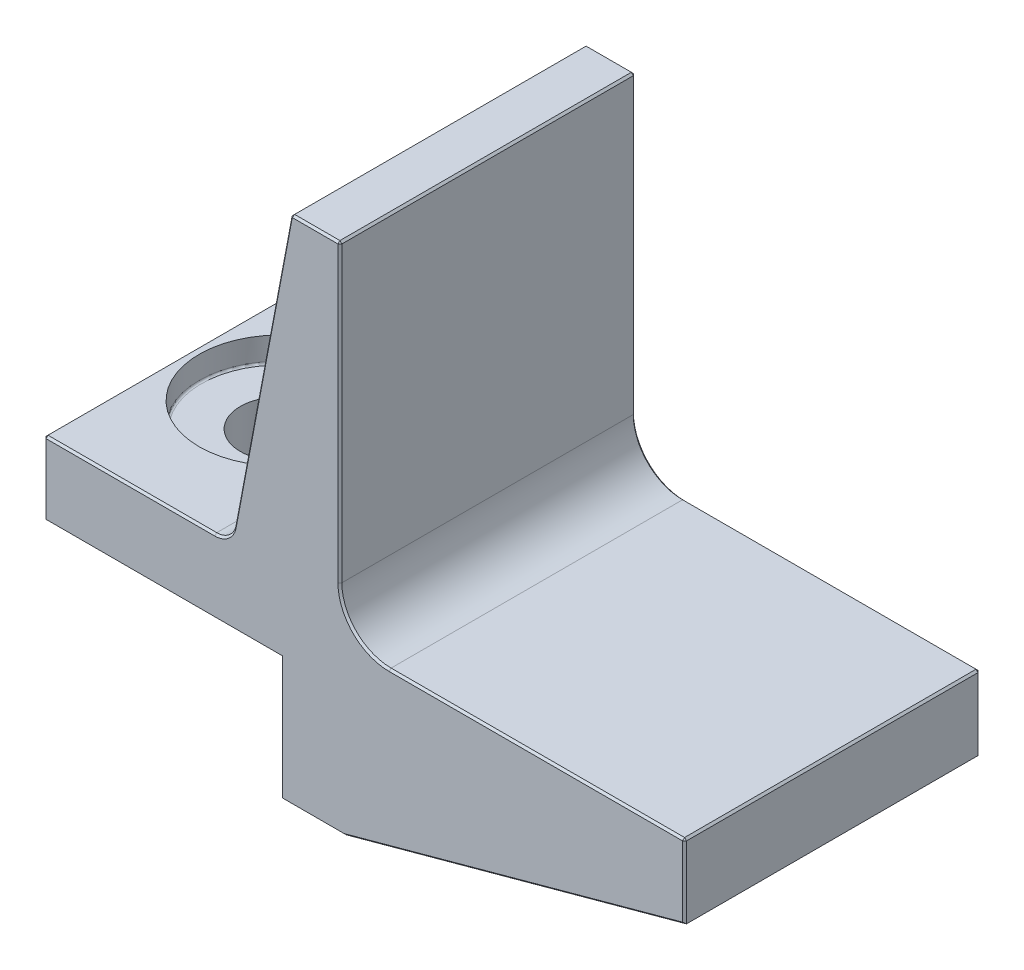
from build123d import *
from OCP.BRepFilletAPI import BRepFilletAPI_MakeChamfer

# Parameters (mm, degrees)
BOSS_EXTRUDE1_DEPTH                                  = 38.1
CBORE_FOR_3_8_BINDING_HEAD_MACHINE_SCREW_D           = 10.0838
CBORE_FOR_3_8_BINDING_HEAD_MACHINE_SCREW_CBORE_D     = 20.6756
CBORE_FOR_3_8_BINDING_HEAD_MACHINE_SCREW_CBORE_DEPTH = 3.175
FILLET1_R                                            = 2.54
FILLET2_R                                            = 6.35
CHAMFER1_SIZE                                        = 0.254
CHAMFER1_SIZE2                                       = 0.31888992
FILLET3_R                                            = 0.254
CHAMFER2_SIZE                                        = 0.254


with BuildPart() as part:
    # Sketch1 → Boss-Extrude1 (new body)
    with BuildSketch(Plane.XY):
        Polygon((0, 0), (44.45, 0), (44.45, -9.525), (0.5741924, -21.517102), (-7.6808076, -21.517102), (-7.6808076, -5.642102), (-38.1608076, -5.642102), (-38.1608076, 3.882898), (-14.0308076, 3.882898), (-6.35, 44.45), (0, 44.45), align=None)
    extrude(amount=BOSS_EXTRUDE1_DEPTH)

    # CBORE for 3/8 Binding Head Machine Screw1 (through all)
    with Locations(Plane(origin=(0, 3.882898, 0), x_dir=(1, 0, 0), z_dir=(0, 1, 0))):
        with Locations((-26.8578076, -19.05)):
            CounterBoreHole(CBORE_FOR_3_8_BINDING_HEAD_MACHINE_SCREW_D / 2, CBORE_FOR_3_8_BINDING_HEAD_MACHINE_SCREW_CBORE_D / 2, CBORE_FOR_3_8_BINDING_HEAD_MACHINE_SCREW_CBORE_DEPTH)

    # Fillet1
    fillet1_edges = [part.edges().sort_by_distance(p)[0] for p in [
        (-14.0308076, 3.882898, 19.05),
    ]]
    fillet(fillet1_edges, radius=FILLET1_R)

    # Fillet2
    fillet2_edges = [part.edges().sort_by_distance(p)[0] for p in [
        (0, 0, 19.05),
    ]]
    fillet(fillet2_edges, radius=FILLET2_R)

    # Chamfer1: one chamfer whose edges measure the first distance from different faces: ONE call of the kernel's chamfer builder (chamfer() names one face for all edges)
    chamfer1_edges_1 = [part.edges().sort_by_distance(p)[0] for p in [
        (-6.35, 44.45, 19.05),
    ]]
    chamfer1_side_1 = [part.faces().sort_by_distance(p)[0] for p in [
        (-3.175, 44.45, 19.05),
    ]]
    chamfer1_edges_2 = [part.edges().sort_by_distance(p)[0] for p in [
        (-3.175, 44.45, 0),
        (-3.175, 44.45, 38.1),
        (0, 44.45, 19.05),
        (-9.994679571, 25.200189874, 0),
        (-9.994679571, 25.200189874, 38.1),
        (-14.514618931, 4.466907668, 0),
        (-14.514618931, 4.466907668, 38.1),
        (-27.147914139, 3.882898, 0),
        (-38.1608076, 3.882898, 19.05),
        (-27.147914139, 3.882898, 38.1),
        (-38.1608076, -0.879602, 0),
        (-38.1608076, -5.642102, 19.05),
        (-38.1608076, -0.879602, 38.1),
        (-22.9208076, -5.642102, 0),
        (-22.9208076, -5.642102, 38.1),
        (44.45, -4.7625, 0),
        (44.45, -4.7625, 38.1),
        (44.45, 0, 19.05),
        (25.4, 0, 0),
        (1.859871939, 1.859871939, 0),
        (1.859871939, 1.859871939, 38.1),
        (0, 25.4, 0),
        (0, 25.4, 38.1),
        (25.4, 0, 38.1),
        (-7.6808076, -13.579602, 0),
        (-7.6808076, -13.579602, 38.1),
        (-3.5533076, -21.517102, 0),
        (-3.5533076, -21.517102, 38.1),
        (22.5120962, -15.521051, 0),
        (22.5120962, -15.521051, 38.1),
    ]]
    chamfer1 = BRepFilletAPI_MakeChamfer(part.part.solid().wrapped)
    for e in chamfer1_edges_1:
        chamfer1.Add(CHAMFER1_SIZE, CHAMFER1_SIZE2, e.wrapped, chamfer1_side_1[0].wrapped)  # the first distance lies on this face
    for e in chamfer1_edges_2:
        chamfer1.Add(CHAMFER1_SIZE, e.wrapped)
    add(Compound.cast(chamfer1.Shape()), mode=Mode.REPLACE)

    # Fillet3
    fillet3_edges = [part.edges().sort_by_distance(p)[0] for p in [
        (-37.1956076, 0.707898, 19.05),
    ]]
    fillet(fillet3_edges, radius=FILLET3_R)

    # Chamfer2
    chamfer2_edges = [part.edges().sort_by_distance(p)[0] for p in [
        (-21.8159076, -5.642102, 19.05),
    ]]
    chamfer(chamfer2_edges, length=CHAMFER2_SIZE)


solid = part.part
